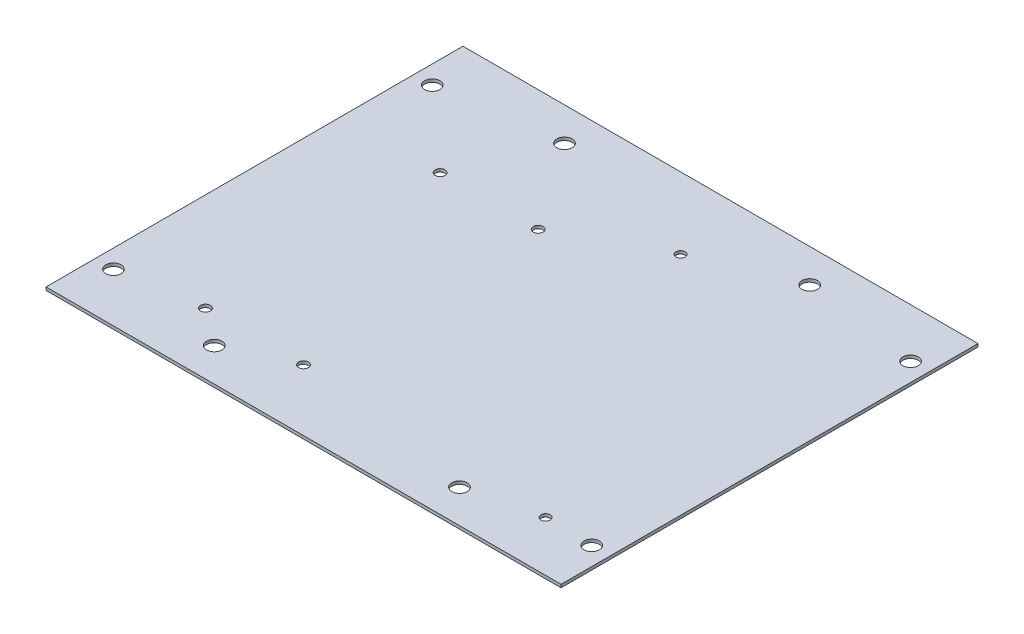
from build123d import *

# Parameters (mm, degrees)
SKETCH1_W               = 266.7
SKETCH1_H               = 215.9
BASE_FLANGE1_DEPTH      = 1.5748
SKETCH6_R               = 3.96875
CUT_EXTRUDE1_DEPTH      = 1.5748
SKETCH7_R               = 3.96875
CUT_EXTRUDE2_DEPTH      = 172.574779601
MIRROR2_COPY_1_SKETCH_R = 3.96875
MIRROR2_COPY_1_DEPTH    = 1.5748
MIRROR2_COPY_2_SKETCH_R = 3.96875
MIRROR2_COPY_2_DEPTH    = 172.574779601
SKETCH8_R               = 2.54
CUT_EXTRUDE3_DEPTH      = 172.574779601
SKETCH9_R               = 2.38125
CUT_EXTRUDE4_DEPTH      = 172.574779601


# Sheet-metal steps are written as plain solids
with BuildPart() as part:
    # Sketch1 → Base-Flange1 (new body)
    with BuildSketch(Plane(origin=(0, 0, 0), x_dir=(1, 0, 0), z_dir=(0, 1, 0))):
        Rectangle(SKETCH1_W, SKETCH1_H)
    extrude(amount=-BASE_FLANGE1_DEPTH)

    # Sketch6 → Cut-Extrude1 (cut)
    with BuildSketch(Plane(origin=(0, 0, 0), x_dir=(1, 0, 0), z_dir=(0, 1, 0))):
        with Locations(Location((-123.825, -82.55, 0), (0, 0, 270))):
            Circle(SKETCH6_R)
    cut_extrude1 = extrude(amount=-CUT_EXTRUDE1_DEPTH, mode=Mode.SUBTRACT)

    # Sketch7 → Cut-Extrude2 (cut, through all)
    with BuildSketch(Plane(origin=(0, 0, 0), x_dir=(1, 0, 0), z_dir=(0, 1, 0))):
        with Locations(Location((-63.5, -90.678, 0), (0, 0, 270))):
            Circle(SKETCH7_R)
    cut_extrude2 = extrude(amount=-CUT_EXTRUDE2_DEPTH, mode=Mode.SUBTRACT)

    # Mirror1: Cut-Extrude1, Cut-Extrude2 across plane
    add(cut_extrude1.mirror(Plane(origin=(0, 0, 0), x_dir=(0, 0, 1), z_dir=(1, 0, 0))), mode=Mode.SUBTRACT)
    add(cut_extrude2.mirror(Plane(origin=(0, 0, 0), x_dir=(0, 0, 1), z_dir=(1, 0, 0))), mode=Mode.SUBTRACT)

    # Mirror2: Cut-Extrude1, Cut-Extrude2 across plane
    add(cut_extrude1.mirror(Plane.XY), mode=Mode.SUBTRACT)
    add(cut_extrude2.mirror(Plane.XY), mode=Mode.SUBTRACT)

    # Mirror2 copy 1 sketch → Mirror2 copy 1 (cut)
    with BuildSketch(Plane(origin=(0, 0, 0), x_dir=(-1, 0, 0), z_dir=(0, 1, 0))):
        with Locations(Location((-123.825, -82.55, 0), (0, 0, 270))):
            Circle(MIRROR2_COPY_1_SKETCH_R)
    extrude(amount=-MIRROR2_COPY_1_DEPTH, mode=Mode.SUBTRACT)

    # Mirror2 copy 2 sketch → Mirror2 copy 2 (cut, through all)
    with BuildSketch(Plane(origin=(0, 0, 0), x_dir=(-1, 0, 0), z_dir=(0, 1, 0))):
        with Locations(Location((-63.5, -90.678, 0), (0, 0, 270))):
            Circle(MIRROR2_COPY_2_SKETCH_R)
    extrude(amount=-MIRROR2_COPY_2_DEPTH, mode=Mode.SUBTRACT)

    # Sketch8 → Cut-Extrude3 (cut, through all)
    with BuildSketch(Plane(origin=(0, 0, 0), x_dir=(1, 0, 0), z_dir=(0, 1, 0))):
        with Locations(Location((-82.55, -76.2, 0), (0, 0, 270))):
            Circle(SKETCH8_R)
        with Locations(Location((-31.75, -76.2, 0), (0, 0, 270))):
            Circle(SKETCH8_R)
        with Locations(Location((-82.55, 45.339, 0), (0, 0, 270))):
            Circle(SKETCH8_R)
        with Locations(Location((-31.75, 45.339, 0), (0, 0, 270))):
            Circle(SKETCH8_R)
    extrude(amount=-CUT_EXTRUDE3_DEPTH, mode=Mode.SUBTRACT)

    # Sketch9 → Cut-Extrude4 (cut, through all)
    with BuildSketch(Plane(origin=(0, 0, 0), x_dir=(1, 0, 0), z_dir=(0, 1, 0))):
        with Locations(Location((99.35, -81.95, 0), (0, 0, 270))):
            Circle(SKETCH9_R)
        with Locations(Location((16.35, 70.95, 0), (0, 0, 270))):
            Circle(SKETCH9_R)
    extrude(amount=-CUT_EXTRUDE4_DEPTH, mode=Mode.SUBTRACT)


solid = part.part
